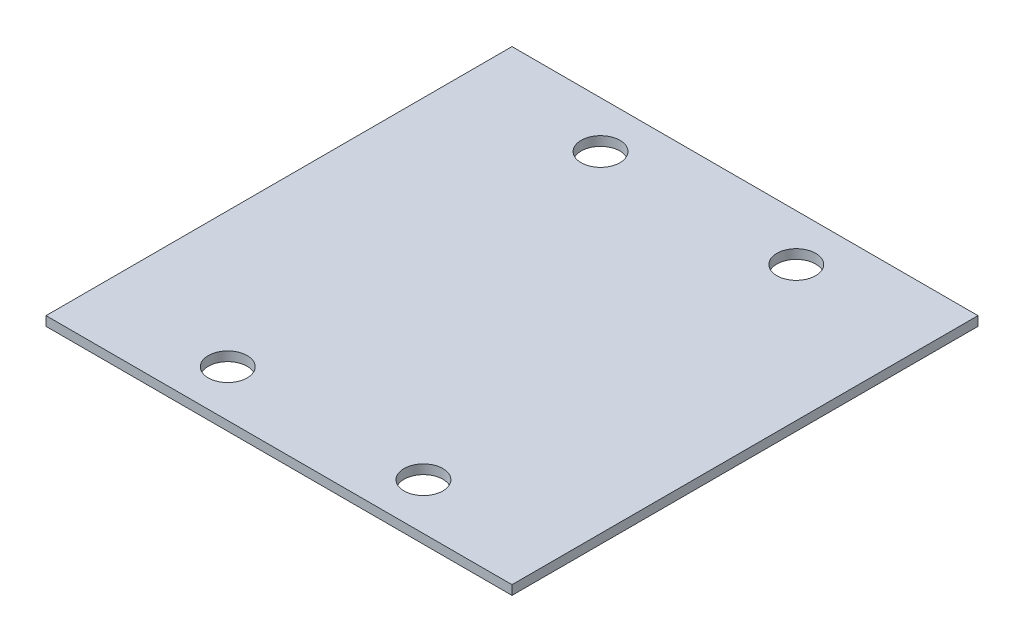
from build123d import *

# Parameters (mm, degrees)
SKETCH1_W           = 76.2
SKETCH1_H           = 76.2
BOSS_EXTRUDE1_DEPTH = 1.524
SKETCH3_R           = 3.175
CUT_EXTRUDE3_DEPTH  = 54.903085032


with BuildPart() as part:
    # Sketch1 → Boss-Extrude1 (new body)
    with BuildSketch(Plane(origin=(0, 0, 0), x_dir=(1, 0, 0), z_dir=(0, 1, 0))):
        Rectangle(SKETCH1_W, SKETCH1_H)
    extrude(amount=BOSS_EXTRUDE1_DEPTH)

    # Sketch3 → Cut-Extrude3 (cut, through all)
    with BuildSketch(Plane(origin=(0, 0, 0), x_dir=(1, 0, 0), z_dir=(0, 1, 0))):
        with Locations((-16.002, 30.48)):
            Circle(SKETCH3_R)
        with Locations((-16.002, -30.48)):
            Circle(SKETCH3_R)
        with Locations((16.002, -30.48)):
            Circle(SKETCH3_R)
        with Locations((16.002, 30.48)):
            Circle(SKETCH3_R)
    extrude(amount=CUT_EXTRUDE3_DEPTH, mode=Mode.SUBTRACT)


solid = part.part
